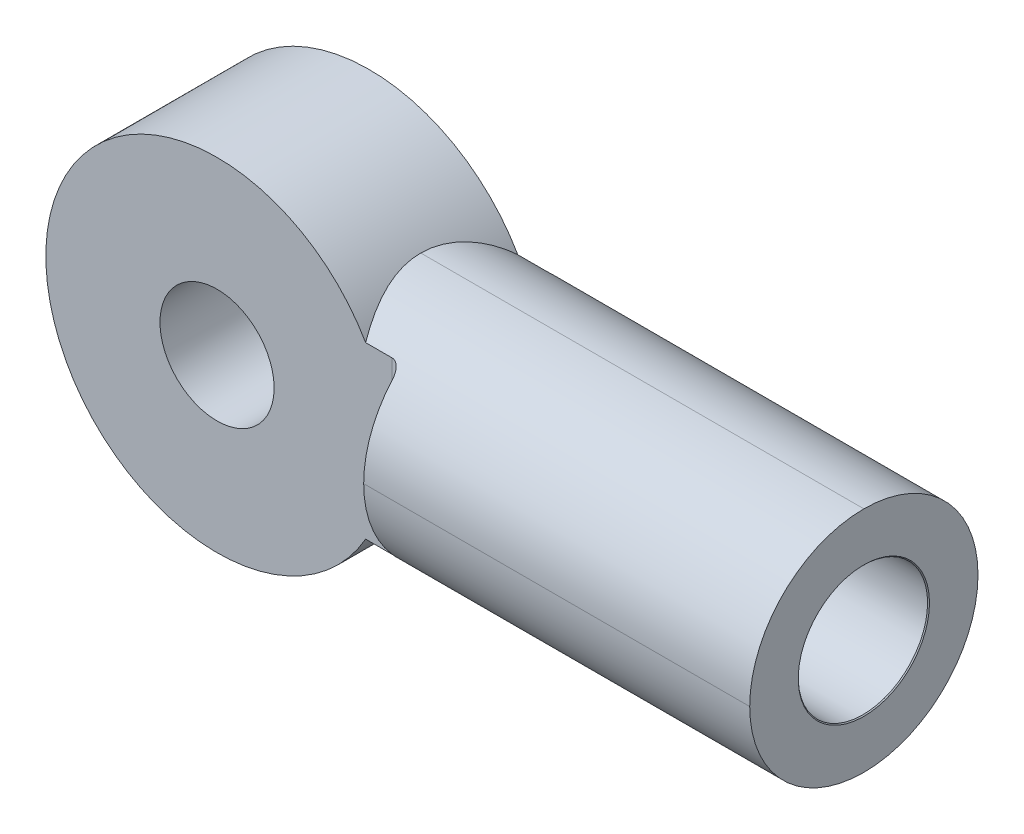
from build123d import *

# Parameters (mm, degrees)
BOSS_EXTRU_2_DEPTH         = 6
ENL_V_START                = -1
ENL_V_MAT_EXTRU_1_DEPTH    = 1
ENL_V_MAT_EXTRU_2_DEPTH    = 1
CONG_4_R                   = 3
CONG_5_R                   = 0.25
D_GAGEMENT_M31_D           = 3.4
D_GAGEMENT_M31_DEPTH       = 5
D_GAGEMENT_M31_CSINK_D     = 3.45
D_GAGEMENT_M31_CSINK_ANGLE = 90
D_GAGEMENT_M31_TIP         = 1.021463052
ESQUISSE9_R                = 1.5
ENL_V_MAT_EXTRU_3_DEPTH    = 17.439282372


with BuildPart() as part:
    # Esquisse1 → Boss.-Extru.2 (new body)
    with BuildSketch(Plane.XY):
        with BuildLine():
            Line((3.354101966, 3), (15, 3))
            Line((15, 3), (15, -3))
            Line((15, -3), (3.354101966, -3))
            ThreePointArc((3.354101966, -3), (-4.5, 0), (3.354101966, 3))
        make_face()
    extrude(amount=BOSS_EXTRU_2_DEPTH)

    # Esquisse5 → Enlèv. mat.-Extru.1 (cut)
    with BuildSketch(Plane.XY.offset(6).offset(ENL_V_START)):
        with BuildLine():
            Line((3.354101966, 3), (4.854101966, 3))
            Line((4.854101966, 3), (4.854101966, -3))
            Line((4.854101966, -3), (3.354101966, -3))
            ThreePointArc((3.354101966, -3), (-4.5, 0), (3.354101966, 3))
        make_face()
    extrude(amount=ENL_V_MAT_EXTRU_1_DEPTH, mode=Mode.SUBTRACT)

    # Esquisse6 → Enlèv. mat.-Extru.2 (cut)
    with BuildSketch(Plane(origin=(0, 0, 0), x_dir=(-1, 0, 0), z_dir=(0, 0, -1))):
        with BuildLine():
            Line((-3.354101966, 3), (-4.854101966, 3))
            Line((-4.854101966, 3), (-4.854101966, -3))
            Line((-4.854101966, -3), (-3.354101966, -3))
            ThreePointArc((-3.354101966, -3), (4.5, 0), (-3.354101966, 3))
        make_face()
    extrude(amount=-ENL_V_MAT_EXTRU_2_DEPTH, mode=Mode.SUBTRACT)

    # Congé4
    # the kernel refuses this fillet: 3 mm, written as the material it takes off along each edge
    with BuildSketch(Plane(origin=(22.5, -3, 6), x_dir=(0, 1, 0), z_dir=(-1, 0, 0))) as cong_4_piece_1_section:
        with BuildLine():
            CenterArc((CONG_4_R, CONG_4_R), CONG_4_R, 180, 90)
            Line((0, CONG_4_R), (0, 0))
            Line((0, 0), (CONG_4_R, 0))
        make_face()
    cong_4_piece_1 = extrude(amount=25.145898034, mode=Mode.PRIVATE)
    cong_4_piece_1 = cong_4_piece_1 - Plane(origin=(0, 0, 5.599963302), x_dir=(0.7453559924999289, -0.6666666666666679, 0), z_dir=(0, 0, -1)) * Cylinder(4.5, 63, mode=Mode.PRIVATE)
    add(cong_4_piece_1, mode=Mode.SUBTRACT)
    with BuildSketch(Plane(origin=(22.5, -3, 0), x_dir=(0, 1, 0), z_dir=(-1, 0, 0))) as cong_4_piece_2_section:
        with BuildLine():
            CenterArc((CONG_4_R, -CONG_4_R), CONG_4_R, 90, 90)
            Line((0, -CONG_4_R), (0, 0))
            Line((0, 0), (CONG_4_R, 0))
        make_face()
    cong_4_piece_2 = extrude(amount=25.145898034, mode=Mode.PRIVATE)
    cong_4_piece_2 = cong_4_piece_2 - Plane(origin=(0, 0, 0.400036698), x_dir=(0.7453559924999289, -0.6666666666666679, 0), z_dir=(0, 0, -1)) * Cylinder(4.5, 63, mode=Mode.PRIVATE)
    add(cong_4_piece_2, mode=Mode.SUBTRACT)
    with BuildSketch(Plane(origin=(-2.645898034, 3, 0), x_dir=(0, 0, 1), z_dir=(1, 0, 0))) as cong_4_piece_3_section:
        with BuildLine():
            CenterArc((CONG_4_R, CONG_4_R), CONG_4_R, 180, 90)
            Line((0, CONG_4_R), (0, 0))
            Line((0, 0), (CONG_4_R, 0))
        make_face()
    cong_4_piece_3 = extrude(amount=25.145898034, mode=Mode.PRIVATE)
    cong_4_piece_3 = cong_4_piece_3 - Plane(origin=(0, 0, 1.508382446), x_dir=(0.7453559924999289, -0.6666666666666679, 0), z_dir=(0, 0, -1)) * Cylinder(4.5, 63, mode=Mode.PRIVATE)
    add(cong_4_piece_3, mode=Mode.SUBTRACT)
    with BuildSketch(Plane(origin=(-2.645898034, 3, 6), x_dir=(0, 0, -1), z_dir=(1, 0, 0))) as cong_4_piece_4_section:
        with BuildLine():
            CenterArc((CONG_4_R, -CONG_4_R), CONG_4_R, 90, 90)
            Line((0, -CONG_4_R), (0, 0))
            Line((0, 0), (CONG_4_R, 0))
        make_face()
    cong_4_piece_4 = extrude(amount=25.145898034, mode=Mode.PRIVATE)
    cong_4_piece_4 = cong_4_piece_4 - Plane(origin=(0, 0, 4.491617554), x_dir=(0.7453559924999289, -0.6666666666666679, 0), z_dir=(0, 0, -1)) * Cylinder(4.5, 63, mode=Mode.PRIVATE)
    add(cong_4_piece_4, mode=Mode.SUBTRACT)

    # Congé5
    cong_5_edges = [part.edges().sort_by_distance(p)[0] for p in [
        (4.854101966, 0, 5),
        (4.854101966, 0, 1),
    ]]
    fillet(cong_5_edges, radius=CONG_5_R)

    # Dégagement M31
    with Locations(Plane(origin=(15, 0, 0), x_dir=(0, 0, -1), z_dir=(1, 0, 0))):
        with Locations((-3, 0)):
            CounterSinkHole(D_GAGEMENT_M31_D / 2, D_GAGEMENT_M31_CSINK_D / 2, depth=D_GAGEMENT_M31_DEPTH, counter_sink_angle=D_GAGEMENT_M31_CSINK_ANGLE)
            with Locations((0, 0, -(D_GAGEMENT_M31_DEPTH + D_GAGEMENT_M31_TIP / 2))):  # 118° drill point
                Cone(0, D_GAGEMENT_M31_D / 2, D_GAGEMENT_M31_TIP, mode=Mode.SUBTRACT)

    # Esquisse9 → Enlèv. mat.-Extru.3 (cut, through all)
    with BuildSketch(Plane.XY.offset(5)):
        Circle(ESQUISSE9_R)
    extrude(amount=-ENL_V_MAT_EXTRU_3_DEPTH, mode=Mode.SUBTRACT)


solid = part.part
